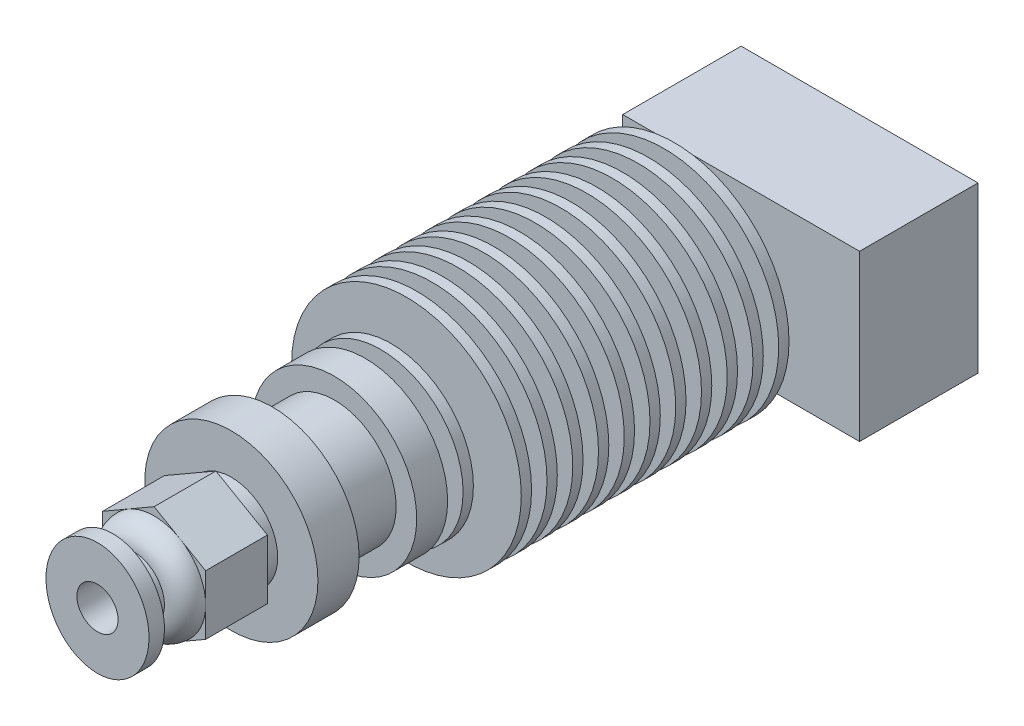
from build123d import *

# Parameters (mm, degrees)
SKETCH_3_R             = 11.15
EXTRUDE_1_DEPTH        = 1
PATTERN_LINEAR_1_COUNT = 11
PATTERN_LINEAR_1_PITCH = 2.5
SKETCH_4_R             = 4.25
EXTRUDE_2_DEPTH        = 1.5
SKETCH_5_R             = 8
EXTRUDE_3_DEPTH        = 1
SKETCH_6_R             = 4.25
EXTRUDE_4_DEPTH        = 1.5
SKETCH_7_R             = 8
EXTRUDE_5_DEPTH        = 3
SKETCH_8_R             = 6
EXTRUDE_6_DEPTH        = 6
SKETCH_9_R             = 8.406563738
EXTRUDE_7_DEPTH        = 4
SKETCH_10_R            = 2.5
EXTRUDE_8_DEPTH        = 3
SKETCH_11_W            = 23
SKETCH_11_H            = 16
EXTRUDE_9_DEPTH        = 11.5
EXTRUDE_10_DEPTH       = 3
SKETCH_13_R            = 2
EXTRUDE_11_DEPTH       = 2
EXTRUDE_11_TAPER       = 35
SKETCH_14_R            = 4.5
EXTRUDE_12_DEPTH       = 1.5
EXTRUDE_13_DEPTH       = 6
SKETCH_16_R            = 5
EXTRUDE_14_DEPTH       = 2
FILLET_1_R             = 2
SKETCH_17_R            = 3
EXTRUDE_15_DEPTH       = 1
EXTRUDE_START          = 1
SKETCH_18_R            = 2.5
EXTRUDE_16_DEPTH       = 1
SKETCH_19_RX           = 5.5
SKETCH_19_RY           = 5
EXTRUDE_17_DEPTH       = 1.5
SKETCH_20_R            = 2
CUT_EXTRUDE_1_DEPTH    = 60


with BuildPart() as part:
    # По сечениям1: read off the stored shape, not the designer's step
    # По сечениям1: loft between two sections, ruled curve by curve
    loft_1_from = [
        Edge.make_bspline([(3.249004009, 2.739794327, 26), (8.728592662, -3.75821369, 26), (2.230584645, -9.237802344, 26), (-3.249004009, -2.739794327, 26), (-8.728592662, 3.75821369, 26), (-2.230584645, 9.237802344, 26), (3.249004009, 2.739794327, 26)], [0, 0, 0, 0, 0.5, 0.5, 0.5, 1, 1, 1, 1], 3, [1, 0.333333333, 0.333333333, 1, 0.333333333, 0.333333333, 1]),
    ]
    loft_1_to = [
        Edge.make_bspline([(5.561846941, 2.250746233, 0), (10.063339406, -8.872947649, 0), (-1.060354476, -13.374440115, 0), (-5.561846941, -2.250746233, 0), (-10.063339406, 8.872947649, 0), (1.060354476, 13.374440115, 0), (5.561846941, 2.250746233, 0)], [0, 0, 0, 0, 0.5, 0.5, 0.5, 1, 1, 1, 1], 3, [1, 0.333333333, 0.333333333, 1, 0.333333333, 0.333333333, 1]),
    ]
    loft_1 = Solid(Shell([*[Face.make_surface_from_curves(loft_1_from[k], loft_1_to[k]) for k in range(1)], Face(Wire(loft_1_from)), Face(Wire(loft_1_to))]))
    add(loft_1)

    # Эскиз3 → Бобышка-Вытянуть1 (add)
    with BuildSketch(Plane(origin=(0, 0, 0), x_dir=(-1, 0, 0), z_dir=(0, 0, -1))):
        Circle(SKETCH_3_R)
    extrude_1 = extrude(amount=-EXTRUDE_1_DEPTH)

    # Линейный массив1: Бобышка-Вытянуть1 ×11
    with Locations(*[(0, 0, i * PATTERN_LINEAR_1_PITCH) for i in range(1, PATTERN_LINEAR_1_COUNT)]):
        add(extrude_1)

    # Эскиз4 → Бобышка-Вытянуть2 (add)
    with BuildSketch(Plane.XY.offset(26)):
        Circle(SKETCH_4_R)
    extrude(amount=EXTRUDE_2_DEPTH)

    # Эскиз5 → Бобышка-Вытянуть3 (add)
    with BuildSketch(Plane.XY.offset(27.5)):
        Circle(SKETCH_5_R)
    extrude(amount=EXTRUDE_3_DEPTH)

    # Эскиз6 → Бобышка-Вытянуть4 (add)
    with BuildSketch(Plane.XY.offset(28.5)):
        Circle(SKETCH_6_R)
    extrude(amount=EXTRUDE_4_DEPTH)

    # Эскиз7 → Бобышка-Вытянуть5 (add)
    with BuildSketch(Plane.XY.offset(30)):
        Circle(SKETCH_7_R)
    extrude(amount=EXTRUDE_5_DEPTH)

    # Эскиз8 → Бобышка-Вытянуть6 (add)
    with BuildSketch(Plane.XY.offset(33)):
        Circle(SKETCH_8_R)
    extrude(amount=EXTRUDE_6_DEPTH)

    # Эскиз9 → Бобышка-Вытянуть7 (add)
    with BuildSketch(Plane.XY.offset(39)):
        Circle(SKETCH_9_R)
    extrude(amount=EXTRUDE_7_DEPTH)

    # Эскиз10 → Бобышка-Вытянуть8 (add)
    with BuildSketch(Plane(origin=(0, 0, 0), x_dir=(-1, 0, 0), z_dir=(0, 0, -1))):
        with Locations(Location((0, 0, 0), (0, 0, 180))):
            Circle(SKETCH_10_R)
    extrude(amount=EXTRUDE_8_DEPTH)

    # Эскиз11 → Бобышка-Вытянуть9 (add)
    with BuildSketch(Plane(origin=(0, 0, -3), x_dir=(-1, 0, 0), z_dir=(0, 0, -1))):
        with Locations((-3.5, 0)):
            Rectangle(SKETCH_11_W, SKETCH_11_H)
    extrude(amount=EXTRUDE_9_DEPTH)

    # Эскиз12 → Бобышка-Вытянуть10 (add)
    with BuildSketch(Plane(origin=(0, 0, -14.5), x_dir=(-1, 0, 0), z_dir=(0, 0, -1))):
        Polygon((0, 4.041451884), (-3.5, 2.020725942), (-3.5, -2.020725942), (0, -4.041451884), (3.5, -2.020725942), (3.5, 2.020725942), align=None)
    extrude(amount=EXTRUDE_10_DEPTH)

    # Эскиз13 → Бобышка-Вытянуть11 (add)
    with BuildSketch(Plane(origin=(0, 0, -17.5), x_dir=(-1, 0, 0), z_dir=(0, 0, -1))):
        Circle(SKETCH_13_R)
    extrude(amount=EXTRUDE_11_DEPTH, taper=EXTRUDE_11_TAPER)

    # Эскиз14 → Бобышка-Вытянуть12 (add)
    with BuildSketch(Plane.XY.offset(43)):
        Circle(SKETCH_14_R)
    extrude(amount=EXTRUDE_12_DEPTH)

    # Эскиз15 → Бобышка-Вытянуть13 (add)
    with BuildSketch(Plane.XY.offset(44.5)):
        Polygon((0, 5.773502692), (-5, 2.886751346), (-5, -2.886751346), (0, -5.773502692), (5, -2.886751346), (5, 2.886751346), align=None)
    extrude(amount=EXTRUDE_13_DEPTH)

    # Эскиз16 → Бобышка-Вытянуть14 (add)
    with BuildSketch(Plane.XY.offset(50.5)):
        Circle(SKETCH_16_R)
    extrude(amount=EXTRUDE_14_DEPTH)

    # Скругление1
    fillet_1_edges = [part.edges().sort_by_distance(p)[0] for p in [
        (-5, 0, 52.5),
    ]]
    fillet(fillet_1_edges, radius=FILLET_1_R - 0.0001)  # a hair under: the kernel refuses the full size

    # Эскиз17 → Бобышка-Вытянуть15 (add)
    with BuildSketch(Plane.XY.offset(52.5)):
        Circle(SKETCH_17_R)
    extrude(amount=EXTRUDE_15_DEPTH)

    # Эскиз18 → Бобышка-Вытянуть16 (add)
    with BuildSketch(Plane.XY.offset(53.5).offset(EXTRUDE_START)):
        Circle(SKETCH_18_R)
    extrude(amount=-EXTRUDE_16_DEPTH)

    # Эскиз19 → Бобышка-Вытянуть17 (add)
    with BuildSketch(Plane.XY.offset(54.5)):
        with Locations(Location((0, 0), (0, 0, -90))):
            Ellipse(SKETCH_19_RX, SKETCH_19_RY)
    extrude(amount=EXTRUDE_17_DEPTH)

    # Эскиз20 → Вырез-Вытянуть1 (cut)
    with BuildSketch(Plane.XY.offset(56)):
        Circle(SKETCH_20_R)
    extrude(amount=-CUT_EXTRUDE_1_DEPTH, mode=Mode.SUBTRACT)


solid = part.part
